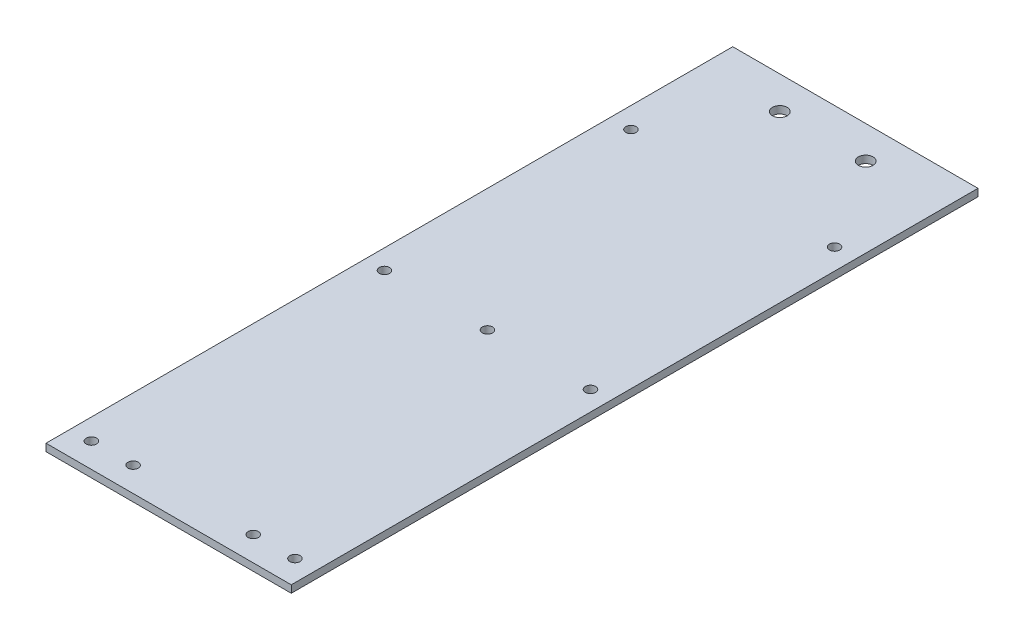
from build123d import *

# Parameters (mm, degrees)
SKETCH1_R             = 2.1
BOSS_EXTRUDE1_DEPTH   = 3
BOSS_EXTRUDE1_2_DEPTH = 3
BOSS_EXTRUDE1_3_DEPTH = 3
SKETCH1_W             = 100
SKETCH1_H             = 120
BOSS_EXTRUDE1_4_DEPTH = 3
SKETCH2_R             = 2.1
CUT_EXTRUDE1_DEPTH    = 10
SKETCH3_W             = 100
SKETCH3_H             = 3
BOSS_EXTRUDE2_DEPTH   = 160
SKETCH4_R             = 3
SKETCH4_R_2           = 2.1
CUT_EXTRUDE2_DEPTH    = 160
SKETCH5_R             = 2.1
CUT_EXTRUDE3_DEPTH    = 10


with BuildPart() as part:
    # Sketch1 → Boss-Extrude1 (new body)
    with BuildSketch(Plane(origin=(0, 0, 0), x_dir=(1, 0, 0), z_dir=(0, 1, 0))):
        with Locations((-42, 70)):
            Circle(SKETCH1_R)
    extrude(amount=BOSS_EXTRUDE1_DEPTH)


with BuildPart() as body_2:
    # Sketch1 → Boss-Extrude1 2 (new body)
    with BuildSketch(Plane(origin=(0, 0, 0), x_dir=(1, 0, 0), z_dir=(0, 1, 0))):
        with Locations((0, 70)):
            Circle(SKETCH1_R)
    extrude(amount=BOSS_EXTRUDE1_2_DEPTH)


with BuildPart() as body_3:
    # Sketch1 → Boss-Extrude1 3 (new body)
    with BuildSketch(Plane(origin=(0, 0, 0), x_dir=(1, 0, 0), z_dir=(0, 1, 0))):
        with Locations((42, 70)):
            Circle(SKETCH1_R)
    extrude(amount=BOSS_EXTRUDE1_3_DEPTH)


with BuildPart() as body_4:
    # Sketch1 → Boss-Extrude1 4 (new body)
    with BuildSketch(Plane(origin=(0, 0, 0), x_dir=(1, 0, 0), z_dir=(0, 1, 0))):
        Rectangle(SKETCH1_W, SKETCH1_H)
        with Locations((41.5, -50)):
            Circle(SKETCH1_R, mode=Mode.SUBTRACT)
        with Locations((-41.5, -50)):
            Circle(SKETCH1_R, mode=Mode.SUBTRACT)
    extrude(amount=BOSS_EXTRUDE1_4_DEPTH)

    # Sketch2 → Cut-Extrude1 (cut)
    with BuildSketch(Plane.XZ):
        with Locations((24.5, 50)):
            Circle(SKETCH2_R)
        with Locations((-24.5, 50)):
            Circle(SKETCH2_R)
    extrude(amount=-CUT_EXTRUDE1_DEPTH, mode=Mode.SUBTRACT)

    # Sketch3 → Boss-Extrude2 (add)
    with BuildSketch(Plane(origin=(0, 0, -60), x_dir=(-1, 0, 0), z_dir=(0, 0, -1))):
        with Locations((0, 1.5)):
            Rectangle(SKETCH3_W, SKETCH3_H)
    extrude(amount=BOSS_EXTRUDE2_DEPTH)

    # Sketch4 → Cut-Extrude2 (cut)
    with BuildSketch(Plane.XZ):
        with Locations((17.5, -206.7)):
            Circle(SKETCH4_R)
        with Locations((-17.5, -206.7)):
            Circle(SKETCH4_R)
        with Locations((-41.5, -170)):
            Circle(SKETCH4_R_2)
        with Locations((41.5, -170)):
            Circle(SKETCH4_R_2)
    extrude(amount=-CUT_EXTRUDE2_DEPTH, mode=Mode.SUBTRACT)


with BuildPart() as cut_extrude3_tool:
    # Sketch5 → Cut-Extrude3 (new body)
    with BuildSketch(Plane.XZ):
        with Locations((-42, -70)):
            Circle(SKETCH5_R)
        with Locations((0, -70)):
            Circle(SKETCH5_R)
        with Locations((42, -70)):
            Circle(SKETCH5_R)
    extrude(amount=-CUT_EXTRUDE3_DEPTH)


with BuildPart() as part_1:
    add(part.part)

    # Cut-Extrude3: cut by cut_extrude3_tool
    add(cut_extrude3_tool.part, mode=Mode.SUBTRACT)


with BuildPart() as body_2_1:
    add(body_2.part)

    # Cut-Extrude3: cut by cut_extrude3_tool
    add(cut_extrude3_tool.part, mode=Mode.SUBTRACT)


with BuildPart() as body_3_1:
    add(body_3.part)

    # Cut-Extrude3: cut by cut_extrude3_tool
    add(cut_extrude3_tool.part, mode=Mode.SUBTRACT)


with BuildPart() as body_4_1:
    add(body_4.part)

    # Cut-Extrude3: cut by cut_extrude3_tool
    add(cut_extrude3_tool.part, mode=Mode.SUBTRACT)


solid = body_4_1.part
